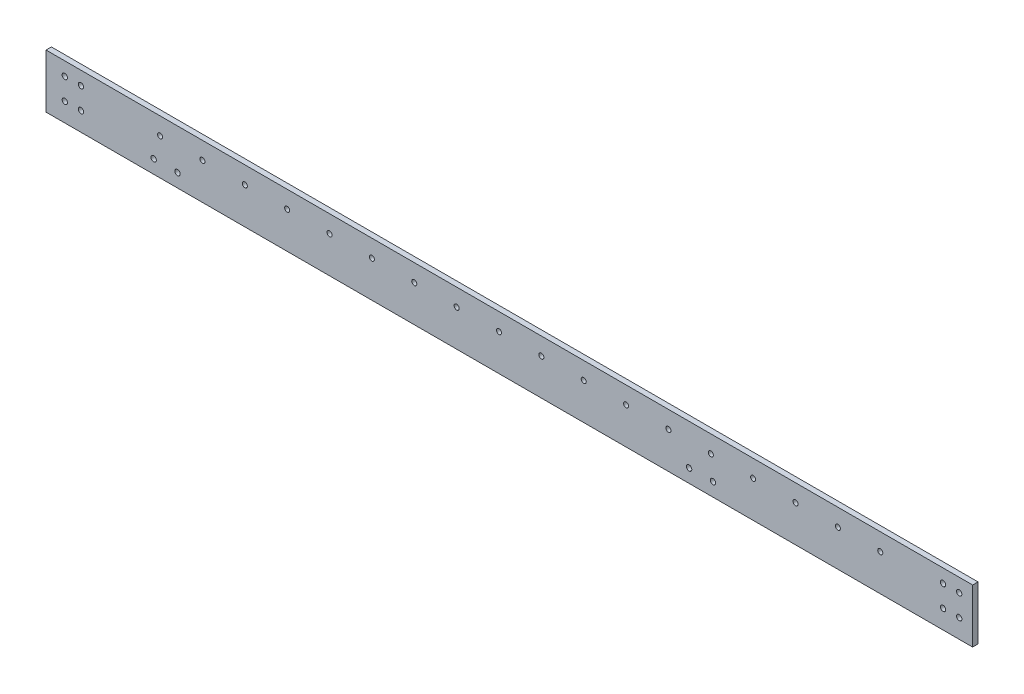
from build123d import *

# Parameters (mm, degrees)
SKETCH1_W                        = 3.175
SKETCH1_H                        = 31.75
BOSS_EXTRUDE1_DEPTH              = 546.825
LEFTSIDEHOLES_SKETCH4_R          = 1.5875
LEFTSIDEHOLES_SKETCH4_R_2        = 1.5
LEFTSIDEHOLES_CUT_EXTRUDE3_DEPTH = 548.755167707


with BuildPart() as part:
    # Sketch1 → Boss-Extrude1 (new body)
    with BuildSketch(Plane(origin=(0, 0, 0), x_dir=(0, 0, -1), z_dir=(1, 0, 0))):
        with Locations((-1.5875, 15.875)):
            Rectangle(SKETCH1_W, SKETCH1_H)
    extrude(amount=BOSS_EXTRUDE1_DEPTH)

    # LeftSideHoles-Sketch4 → LeftSideHoles-Cut-Extrude3 (cut, through all)
    with BuildSketch(Plane.XY.offset(3.175)):
        with Locations((11.1125, 23.8125)):
            Circle(LEFTSIDEHOLES_SKETCH4_R)
        with Locations((529.3625, 23.8125)):
            Circle(LEFTSIDEHOLES_SKETCH4_R)
        with Locations((20.6375, 23.8125)):
            Circle(LEFTSIDEHOLES_SKETCH4_R)
        with Locations((538.8875, 23.8125)):
            Circle(LEFTSIDEHOLES_SKETCH4_R)
        with Locations((11.1125, 11.1125)):
            Circle(LEFTSIDEHOLES_SKETCH4_R)
        with Locations((20.6375, 11.1125)):
            Circle(LEFTSIDEHOLES_SKETCH4_R)
        with Locations((529.3625, 11.1125)):
            Circle(LEFTSIDEHOLES_SKETCH4_R)
        with Locations((538.8875, 11.1125)):
            Circle(LEFTSIDEHOLES_SKETCH4_R)
        with Locations((492.325, 21.525)):
            Circle(LEFTSIDEHOLES_SKETCH4_R_2)
        with Locations((467.325, 21.525)):
            Circle(LEFTSIDEHOLES_SKETCH4_R_2)
        with Locations((442.325, 21.525)):
            Circle(LEFTSIDEHOLES_SKETCH4_R_2)
        with Locations((417.325, 21.525)):
            Circle(LEFTSIDEHOLES_SKETCH4_R_2)
        with Locations((392.325, 21.525)):
            Circle(LEFTSIDEHOLES_SKETCH4_R_2)
        with Locations((367.325, 21.525)):
            Circle(LEFTSIDEHOLES_SKETCH4_R_2)
        with Locations((342.325, 21.525)):
            Circle(LEFTSIDEHOLES_SKETCH4_R_2)
        with Locations((317.325, 21.525)):
            Circle(LEFTSIDEHOLES_SKETCH4_R_2)
        with Locations((292.325, 21.525)):
            Circle(LEFTSIDEHOLES_SKETCH4_R_2)
        with Locations((267.325, 21.525)):
            Circle(LEFTSIDEHOLES_SKETCH4_R_2)
        with Locations((242.325, 21.525)):
            Circle(LEFTSIDEHOLES_SKETCH4_R_2)
        with Locations((217.325, 21.525)):
            Circle(LEFTSIDEHOLES_SKETCH4_R_2)
        with Locations((192.325, 21.525)):
            Circle(LEFTSIDEHOLES_SKETCH4_R_2)
        with Locations((167.325, 21.525)):
            Circle(LEFTSIDEHOLES_SKETCH4_R_2)
        with Locations((142.325, 21.525)):
            Circle(LEFTSIDEHOLES_SKETCH4_R_2)
        with Locations((117.325, 21.525)):
            Circle(LEFTSIDEHOLES_SKETCH4_R_2)
        with Locations((92.325, 21.525)):
            Circle(LEFTSIDEHOLES_SKETCH4_R_2)
        with Locations((67.325, 21.525)):
            Circle(LEFTSIDEHOLES_SKETCH4_R_2)
        with Locations((77.6375, 7.9375)):
            Circle(LEFTSIDEHOLES_SKETCH4_R)
        with Locations((379.5125, 7.9375)):
            Circle(LEFTSIDEHOLES_SKETCH4_R)
        with Locations((63.5125, 7.9375)):
            Circle(LEFTSIDEHOLES_SKETCH4_R)
        with Locations((393.6375, 7.9375)):
            Circle(LEFTSIDEHOLES_SKETCH4_R)
    extrude(amount=-LEFTSIDEHOLES_CUT_EXTRUDE3_DEPTH, mode=Mode.SUBTRACT)


solid = part.part
